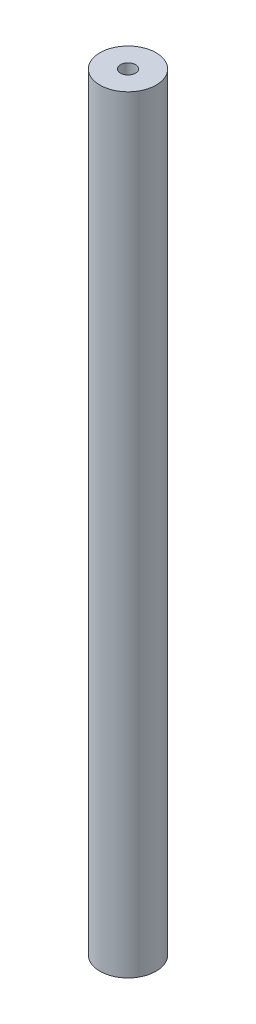
from build123d import *

# Parameters (mm, degrees)
SKETCH1_R           = 7.5
BOSS_EXTRUDE1_DEPTH = 102.5
SKETCH2_R           = 2
CUT_EXTRUDE1_DEPTH  = 15


with BuildPart() as part:
    # Sketch1 → Boss-Extrude1 (new, symmetric)
    with BuildSketch(Plane(origin=(0, 0, 0), x_dir=(1, 0, 0), z_dir=(0, 1, 0))):
        Circle(SKETCH1_R)
    extrude(amount=BOSS_EXTRUDE1_DEPTH, both=True)

    # Sketch2 → Cut-Extrude1 (cut)
    with BuildSketch(Plane(origin=(0, 102.5, 0), x_dir=(1, 0, 0), z_dir=(0, 1, 0))):
        Circle(SKETCH2_R)
    extrude(amount=-CUT_EXTRUDE1_DEPTH, mode=Mode.SUBTRACT)


solid = part.part
